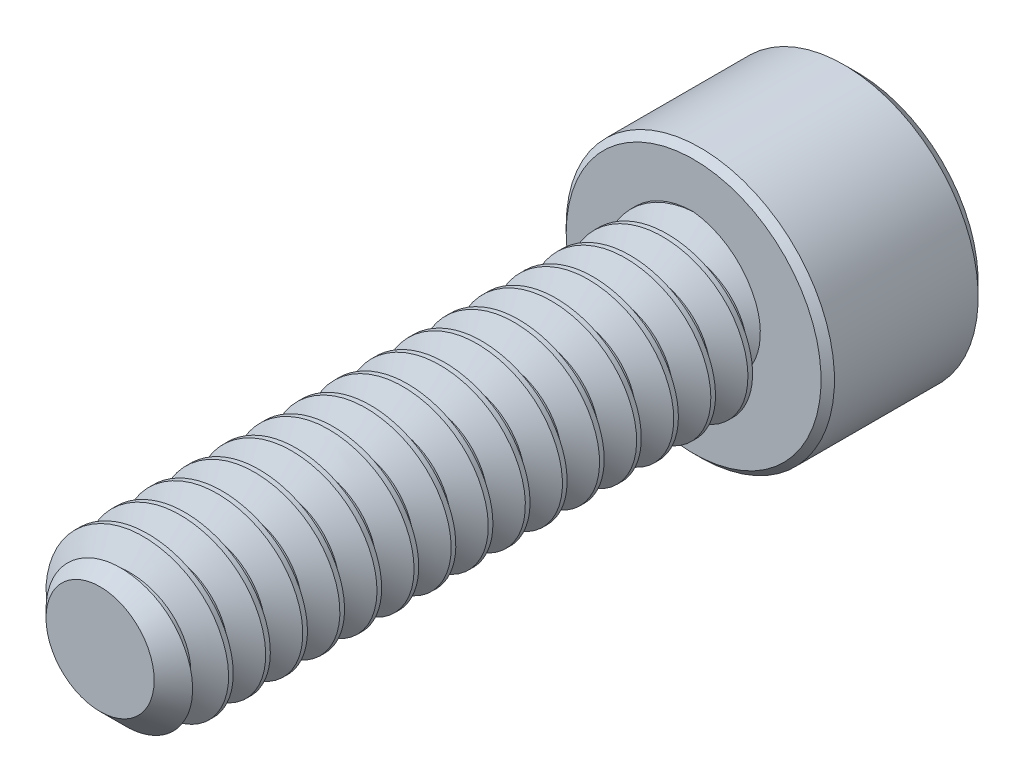
from build123d import *

# Parameters (mm, degrees)
SKETCH1_R          = 1.7526
EXTRUDE1_DEPTH     = 12.7
CHAMFER3_SIZE      = 0.5953125
CUT_SWEEP1_PITCH   = 0.79375
SKETCH6_R          = 2.8702
EXTRUDE2_DEPTH     = 3.5052
CUT_EXTRUDE1_DEPTH = 2.08359375
CHAMFER1_SIZE      = 0.28702
CHAMFER2_SIZE      = 0.14351


with BuildPart() as part:
    # Sketch1 → Extrude1 (new body)
    with BuildSketch(Plane.XY):
        Circle(SKETCH1_R)
    extrude(amount=-EXTRUDE1_DEPTH)

    # Chamfer3
    chamfer3_edges = [part.edges().sort_by_distance(p)[0] for p in [
        (-1.7526, 0, 0),
    ]]
    chamfer(chamfer3_edges, length=CHAMFER3_SIZE)

    # Cut-Sweep1: the profile of Sketch3 profile screwed along a right-hand helix of 17 turns, 6 arcs to a turn; built about Z, then put on its axis
    cut_sweep1_z = Axis((0, 0, 0), (0, 0, 1))
    cut_sweep1_corners = [(1.7529, 0, -0.694704455), (1.237044252, 0, -0.396875), (1.237044252, 0, -0.29765625), (1.7529, 0, 0.000173205)]
    with BuildLine(mode=Mode.PRIVATE) as cut_sweep1_profile:
        Line(cut_sweep1_corners[0], cut_sweep1_corners[1])
        Line(cut_sweep1_corners[1], cut_sweep1_corners[2])
        Line(cut_sweep1_corners[2], cut_sweep1_corners[3])
        Line(cut_sweep1_corners[3], cut_sweep1_corners[0])
    cut_sweep1_cap = Face(cut_sweep1_profile.wire())
    cut_sweep1_turn_angles = [0, 30, 60, 90, 120, 150, 180, 210, 240, 270, 300, 330, 360]
    cut_sweep1_turn_weights = [1, 0.8660254037844387, 1, 0.8660254037844387, 1, 0.8660254037844387, 1, 0.8660254037844387, 1, 0.8660254037844387, 1, 0.8660254037844387, 1]
    cut_sweep1_turn_rails = [Edge.make_bspline([Vector(p[0], p[1], 0).rotate(cut_sweep1_z, cut_sweep1_turn_angles[k]) / cut_sweep1_turn_weights[k] + Vector(0, 0, p[2] + CUT_SWEEP1_PITCH * cut_sweep1_turn_angles[k] / 360) for k in range(13)], [0, 0, 0, 1, 1, 2, 2, 3, 3, 4, 4, 5, 5, 6, 6, 6], 2, cut_sweep1_turn_weights) for p in cut_sweep1_corners]
    cut_sweep1_turn_sides = [Face.make_surface_from_curves(cut_sweep1_turn_rails[p[0]], cut_sweep1_turn_rails[p[1]]) for p in [(0, 1), (1, 2), (2, 3), (3, 0)]]
    cut_sweep1 = Plane(origin=(0, 0, 0), x_dir=(0, 1, 0), z_dir=(0, 0, -1)) * Solid(Shell([*[p.moved(Location((0, 0, CUT_SWEEP1_PITCH * i))) for i in range(17) for p in cut_sweep1_turn_sides], cut_sweep1_cap, cut_sweep1_cap.rotate(cut_sweep1_z, 6120).moved(Location((0, 0, CUT_SWEEP1_PITCH * 6120 / 360)))]))
    add(cut_sweep1, mode=Mode.SUBTRACT)

    # Sketch6 → Extrude2 (add)
    with BuildSketch(Plane(origin=(0, 0, -12.7), x_dir=(-1, 0, 0), z_dir=(0, 0, -1))):
        Circle(SKETCH6_R)
    extrude(amount=EXTRUDE2_DEPTH)

    # Sketch7 → Cut-Extrude1 (cut)
    with BuildSketch(Plane(origin=(0, 0, -16.2052), x_dir=(-1, 0, 0), z_dir=(0, 0, -1))):
        Polygon((0, 1.603951217), (-1.3890625, 0.801975608), (-1.3890625, -0.801975608), (0, -1.603951217), (1.3890625, -0.801975608), (1.3890625, 0.801975608), align=None)
    extrude(amount=-CUT_EXTRUDE1_DEPTH, mode=Mode.SUBTRACT)

    # Cut-Extrude2 cone 1 section (through the dimple's axis) → Cut-Extrude2 (revolve, cut)
    with BuildSketch(Plane(origin=(0, 0, -16.2052), x_dir=(0, 1, 0), z_dir=(1, 0, 0))):
        Polygon((0, 0), (1.603951217, 0), (0, 1.603951217), align=None)
    revolve(axis=Axis((0, 0, -16.2052), (0, 0, 1)), mode=Mode.SUBTRACT)

    # Chamfer1
    chamfer1_edges = [part.edges().sort_by_distance(p)[0] for p in [
        (2.8702, 0, -16.2052),
    ]]
    chamfer(chamfer1_edges, length=CHAMFER1_SIZE)

    # Chamfer2
    chamfer2_edges = [part.edges().sort_by_distance(p)[0] for p in [
        (2.8702, 0, -12.7),
    ]]
    chamfer(chamfer2_edges, length=CHAMFER2_SIZE)


solid = part.part
